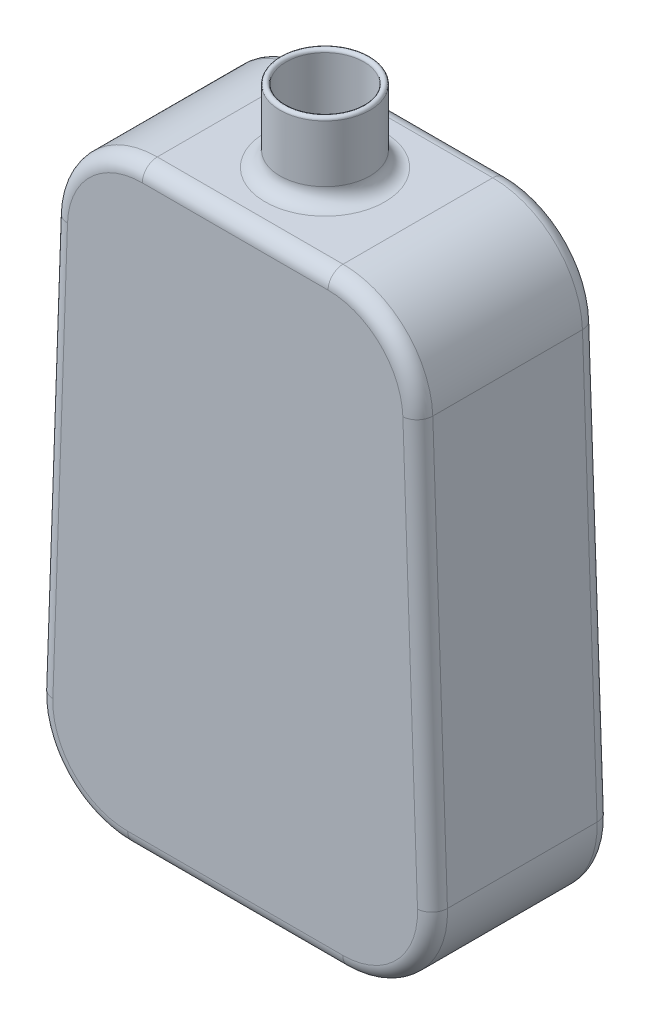
from build123d import *

# Parameters (mm, degrees)
EXTRUDE_1_DEPTH = 30
FILLET_1_R      = 30
SKETCH_2_R      = 15
EXTRUDE_2_DEPTH = 25
SHELL_1_T       = -2
FILLET_3_R      = 5
FILLET_4_R      = 1


with BuildPart() as part:
    # 草图1 → 凸台-拉伸1 (new, symmetric)
    with BuildSketch(Plane.XY):
        with BuildLine():
            Line((60, 100), (-60, 100))
            Line((-60, 100), (-65.899969295, -68.953015099))
            ThreePointArc((-65.899969295, -68.953015099), (-57.498438495, -90.839751114), (-35.918244485, -100))
            Line((-35.918244485, -100), (35.918244485, -100))
            ThreePointArc((35.918244485, -100), (57.498438495, -90.839751114), (65.899969295, -68.953015099))
            Line((65.899969295, -68.953015099), (60, 100))
        make_face()
    extrude(amount=EXTRUDE_1_DEPTH, both=True)

    # 圆角1
    fillet_1_edges = [part.edges().sort_by_distance(p)[0] for p in [
        (-60, 100, 0),
        (60, 100, 0),
    ]]
    fillet(fillet_1_edges, radius=FILLET_1_R)

    # 草图2 → 凸台-拉伸2 (add)
    with BuildSketch(Plane(origin=(0, 100, 0), x_dir=(1, 0, 0), z_dir=(0, 1, 0))):
        Circle(SKETCH_2_R)
    extrude(amount=EXTRUDE_2_DEPTH)

    # 抽壳1
    shell_1_openings = [part.faces().sort_by_distance(p)[0] for p in [
        (0, 125, 0),
    ]]
    offset(amount=SHELL_1_T, openings=shell_1_openings, kind=Kind.INTERSECTION)

    # 圆角3
    fillet_3_edges = [part.edges().sort_by_distance(p)[0] for p in [
        (0, -100, 30),
        (57.498438495, -90.839751114, 30),
        (0, 100, -30),
        (0, 100, 30),
        (63.455515431, 1.046984901, 30),
        (-63.455515431, 1.046984901, -30),
        (-51.86908787, 91.58019401, -30),
        (51.86908787, 91.58019401, -30),
        (-63.455515431, 1.046984901, 30),
        (-51.86908787, 91.58019401, 30),
        (51.86908787, 91.58019401, 30),
        (-15, 100, 0),
        (63.455515431, 1.046984901, -30),
        (57.498438495, -90.839751114, -30),
        (0, -100, -30),
        (-57.498438495, -90.839751114, -30),
        (-57.498438495, -90.839751114, 30),
    ]]
    fillet(fillet_3_edges, radius=FILLET_3_R)

    # 圆角4
    fillet_4_edges = [part.edges().sort_by_distance(p)[0] for p in [
        (-15, 125, 0),
        (-13, 125, 0),
    ]]
    fillet(fillet_4_edges, radius=FILLET_4_R - 0.0001)  # a hair under: the kernel refuses the full size


solid = part.part
